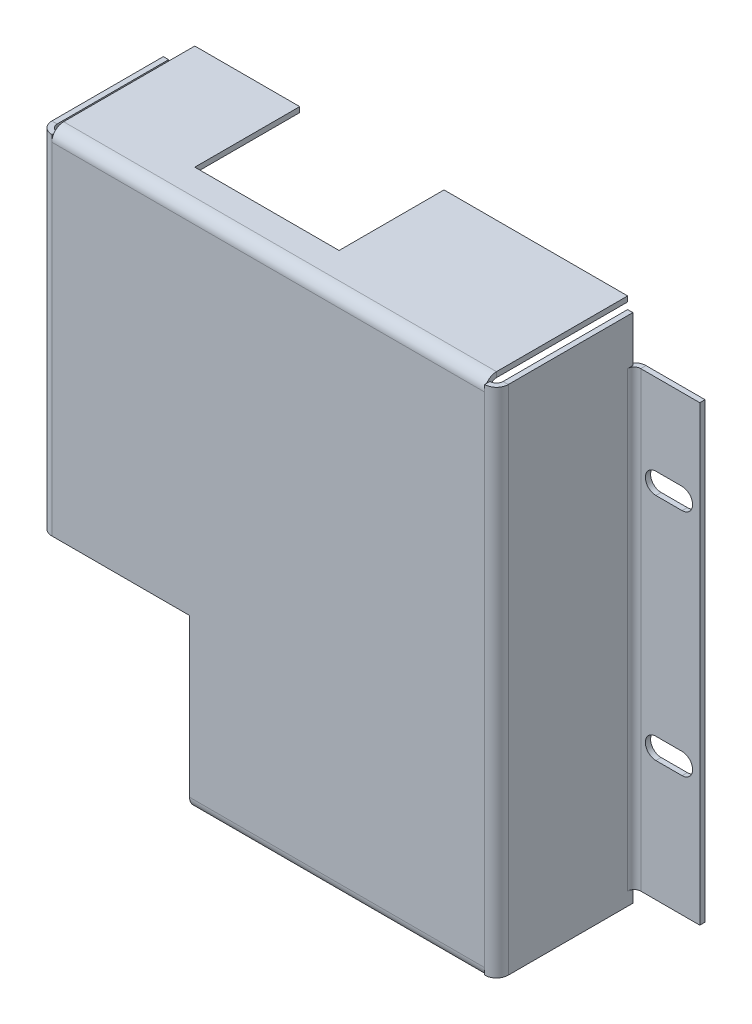
from build123d import *

# Parameters (mm, degrees)
BASE_FLANGE1_DEPTH           = 0.8
EDGE_FLANGE1_STRIP_W         = 5.2
EDGE_FLANGE1_STRIP_H         = 0.8
EDGE_FLANGE1_STRIP_CUT_DEPTH = 53
EDGE_FLANGE1_DEPTH           = 53
EDGE_FLANGE4_STRIP_W         = 5.2
EDGE_FLANGE4_STRIP_H         = 0.8
EDGE_FLANGE4_STRIP_CUT_DEPTH = 78
EDGE_FLANGE4_DEPTH           = 78
EDGE_FLANGE4_START           = 0.8
EDGE_FLANGE4_FLAT_DEPTH      = 0.8
EDGE_FLANGE6_STRIP_W         = 5.2
EDGE_FLANGE6_STRIP_H         = 0.8
EDGE_FLANGE6_STRIP_CUT_DEPTH = 69
EDGE_FLANGE6_DEPTH           = 69
EDGE_FLANGE6_PROFILE_W       = 69
EDGE_FLANGE6_PROFILE_H       = 9
EDGE_FLANGE6_FLAT_DEPTH      = 0.8
EDGE_FLANGE7_STRIP_W         = 5.2
EDGE_FLANGE7_STRIP_H         = 0.8
EDGE_FLANGE7_STRIP_CUT_DEPTH = 45
EDGE_FLANGE7_DEPTH           = 45
EDGE_FLANGE8_STRIP_W         = 5.2
EDGE_FLANGE8_STRIP_H         = 0.8
EDGE_FLANGE8_STRIP_CUT_DEPTH = 66
EDGE_FLANGE8_DEPTH           = 66
EDGE_FLANGE8_START           = 0.8
EDGE_FLANGE8_FLAT_DEPTH      = 0.8


# Sheet-metal steps are written as plain solids
with BuildPart() as part:
    # Sketch1 → Base-Flange1 (new body)
    with BuildSketch(Plane.XY.offset(20.561355821)):
        Polygon((22.147479573, -45.981220417), (-23.852520427, -45.981220417), (-23.852520427, -20.981220417), (-45.852520427, -20.981220417), (-45.852520427, 32.018779583), (22.147479573, 32.018779583), align=None)
    extrude(amount=BASE_FLANGE1_DEPTH)

    # Edge-Flange1 strip (across the edge) → Edge-Flange1 strip cut (cut)
    with BuildSketch(Plane(origin=(-45.852520427, -20.981220417, 20.561355821), x_dir=(1, 0, 0), z_dir=(0, 1, 0))):
        with Locations((-1.6, -0.4)):
            Rectangle(EDGE_FLANGE1_STRIP_W, EDGE_FLANGE1_STRIP_H)
    extrude(amount=EDGE_FLANGE1_STRIP_CUT_DEPTH, mode=Mode.SUBTRACT)

    # Edge-Flange1 section (across the edge) → Edge-Flange1 (add)
    with BuildSketch(Plane(origin=(-45.852520427, -20.981220417, 20.561355821), x_dir=(1, 0, 0), z_dir=(0, 1, 0))):
        with BuildLine():
            Line((-0.8, 1), (-0.8, 18))
            Line((-0.8, 18), (0, 18))
            Line((0, 18), (0, 1))
            ThreePointArc((0, 1), (0.292893219, 0.292893219), (1, 0))
            Line((1, 0), (1, -0.8))
            ThreePointArc((1, -0.8), (-0.272792206, -0.272792206), (-0.8, 1))
        make_face()
    extrude(amount=EDGE_FLANGE1_DEPTH)

    # Edge-Flange4 strip (across the edge) → Edge-Flange4 strip cut (cut)
    with BuildSketch(Plane(origin=(22.147479573, 32.018779583, 20.561355821), x_dir=(-1, 0, 0), z_dir=(0, -1, 0))):
        with Locations((-1.6, -0.4)):
            Rectangle(EDGE_FLANGE4_STRIP_W, EDGE_FLANGE4_STRIP_H)
    extrude(amount=EDGE_FLANGE4_STRIP_CUT_DEPTH, mode=Mode.SUBTRACT)

    # Edge-Flange4 bend section (across the edge) → Edge-Flange4 (add)
    with BuildSketch(Plane(origin=(22.147479573, 32.018779583, 20.561355821), x_dir=(-1, 0, 0), z_dir=(0, -1, 0))):
        with BuildLine():
            Line((-0.8, 1), (0, 1))
            ThreePointArc((0, 1), (0.292893219, 0.292893219), (1, 0))
            Line((1, 0), (1, -0.8))
            ThreePointArc((1, -0.8), (-0.272792206, -0.272792206), (-0.8, 1))
        make_face()
    extrude(amount=EDGE_FLANGE4_DEPTH)

    # Edge-Flange4 profile (on flange) → Edge-Flange4 flat (add)
    with BuildSketch(Plane(origin=(22.147479573, 0, 20.561355821), x_dir=(0, -1, 0), z_dir=(1, 0, 0)).offset(EDGE_FLANGE4_START)):
        Polygon((45.981220417, 1), (45.981220417, 20), (43.981220417, 20), (43.981220417, 21), (-25.018779583, 21), (-25.018779583, 20), (-32.018779583, 20), (-32.018779583, 1), align=None)
    extrude(amount=-EDGE_FLANGE4_FLAT_DEPTH)

    # Edge-Flange6 strip (across the edge) → Edge-Flange6 strip cut (cut)
    with BuildSketch(Plane(origin=(22.947479573, -43.981220417, -0.438644179), x_dir=(0, 0, 1), z_dir=(0, 1, 0))):
        with Locations((-0.8, -0.4)):
            Rectangle(EDGE_FLANGE6_STRIP_W, EDGE_FLANGE6_STRIP_H)
    extrude(amount=EDGE_FLANGE6_STRIP_CUT_DEPTH, mode=Mode.SUBTRACT)

    # Edge-Flange6 bend section (across the edge) → Edge-Flange6 (add)
    with BuildSketch(Plane(origin=(22.947479573, -43.981220417, -0.438644179), x_dir=(0, 0, 1), z_dir=(0, 1, 0))):
        with BuildLine():
            Line((0, 1), (0.8, 1))
            ThreePointArc((0.8, 1), (1.092893219, 0.292893219), (1.8, 0))
            Line((1.8, 0), (1.8, -0.8))
            ThreePointArc((1.8, -0.8), (0.527207794, -0.272792206), (0, 1))
        make_face()
    extrude(amount=EDGE_FLANGE6_DEPTH)

    # Edge-Flange6 profile (on flange) → Edge-Flange6 flat (add)
    with BuildSketch(Plane(origin=(22.947479573, 0, -0.438644179), x_dir=(0, 1, 0), z_dir=(0, 0, -1))):
        with Locations((-9.481220417, 5.5)):
            Rectangle(EDGE_FLANGE6_PROFILE_W, EDGE_FLANGE6_PROFILE_H)
        with BuildLine():
            Line((-25.581220417, 3.3), (-25.581220417, 7.3))
            ThreePointArc((-25.581220417, 7.3), (-23.981220417, 8.9), (-22.381220417, 7.3))
            Line((-22.381220417, 7.3), (-22.381220417, 3.3))
            ThreePointArc((-22.381220417, 3.3), (-23.981220417, 1.7), (-25.581220417, 3.3))
        make_face(mode=Mode.SUBTRACT)
        with BuildLine():
            ThreePointArc((9.418779583, 7.3), (11.018779583, 8.9), (12.618779583, 7.3))
            Line((12.618779583, 7.3), (12.618779583, 3.3))
            ThreePointArc((12.618779583, 3.3), (11.018779583, 1.7), (9.418779583, 3.3))
            Line((9.418779583, 3.3), (9.418779583, 7.3))
        make_face(mode=Mode.SUBTRACT)
    extrude(amount=-EDGE_FLANGE6_FLAT_DEPTH)

    # Edge-Flange7 strip (across the edge) → Edge-Flange7 strip cut (cut)
    with BuildSketch(Plane(origin=(21.147479573, -45.981220417, 20.561355821), x_dir=(0, 1, 0), z_dir=(-1, 0, 0))):
        with Locations((-1.6, -0.4)):
            Rectangle(EDGE_FLANGE7_STRIP_W, EDGE_FLANGE7_STRIP_H)
    extrude(amount=EDGE_FLANGE7_STRIP_CUT_DEPTH, mode=Mode.SUBTRACT)

    # Edge-Flange7 section (across the edge) → Edge-Flange7 (add)
    with BuildSketch(Plane(origin=(21.147479573, -45.981220417, 20.561355821), x_dir=(0, 1, 0), z_dir=(-1, 0, 0))):
        with BuildLine():
            Line((-0.8, 1), (-0.8, 21))
            Line((-0.8, 21), (0, 21))
            Line((0, 21), (0, 1))
            ThreePointArc((0, 1), (0.292893219, 0.292893219), (1, 0))
            Line((1, 0), (1, -0.8))
            ThreePointArc((1, -0.8), (-0.272792206, -0.272792206), (-0.8, 1))
        make_face()
    extrude(amount=EDGE_FLANGE7_DEPTH)

    # Edge-Flange8 strip (across the edge) → Edge-Flange8 strip cut (cut)
    with BuildSketch(Plane(origin=(-44.852520427, 32.018779583, 20.561355821), x_dir=(0, -1, 0), z_dir=(1, 0, 0))):
        with Locations((-1.6, -0.4)):
            Rectangle(EDGE_FLANGE8_STRIP_W, EDGE_FLANGE8_STRIP_H)
    extrude(amount=EDGE_FLANGE8_STRIP_CUT_DEPTH, mode=Mode.SUBTRACT)

    # Edge-Flange8 bend section (across the edge) → Edge-Flange8 (add)
    with BuildSketch(Plane(origin=(-44.852520427, 32.018779583, 20.561355821), x_dir=(0, -1, 0), z_dir=(1, 0, 0))):
        with BuildLine():
            Line((-0.8, 1), (0, 1))
            ThreePointArc((0, 1), (0.292893219, 0.292893219), (1, 0))
            Line((1, 0), (1, -0.8))
            ThreePointArc((1, -0.8), (-0.272792206, -0.272792206), (-0.8, 1))
        make_face()
    extrude(amount=EDGE_FLANGE8_DEPTH)

    # Edge-Flange8 profile (on flange) → Edge-Flange8 flat (add)
    with BuildSketch(Plane(origin=(0, 32.018779583, 20.561355821), x_dir=(1, 0, 0), z_dir=(0, 1, 0)).offset(EDGE_FLANGE8_START)):
        Polygon((21.147479573, 1), (21.147479573, 21), (-6.852520427, 21), (-6.852520427, 5), (-28.852520427, 5), (-28.852520427, 21), (-44.852520427, 21), (-44.852520427, 1), align=None)
    extrude(amount=-EDGE_FLANGE8_FLAT_DEPTH)


solid = part.part
